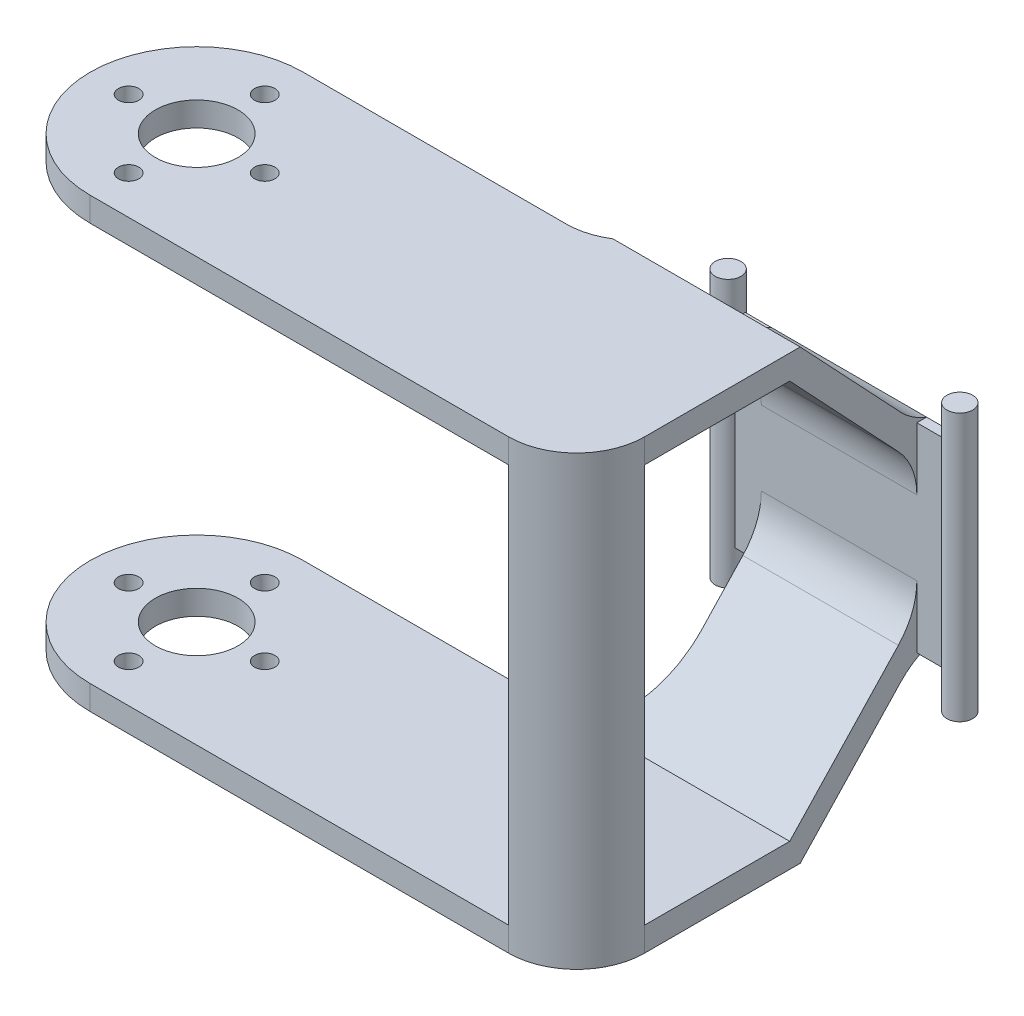
from build123d import *

# Parameters (mm, degrees)
SKETCH1_W           = 23.83
SKETCH1_H           = 1
BOSS_EXTRUDE1_DEPTH = 20.5
SKETCH2_R           = 1.325
BOSS_EXTRUDE2_DEPTH = 13.75
BOSS_EXTRUDE4_DEPTH = 8
SKETCH5_W           = 21.919818374
SKETCH5_H           = 2.5
BOSS_EXTRUDE5_DEPTH = 45
SKETCH6_R           = 4.25
SKETCH6_R_2         = 1.05
CUT_EXTRUDE1_DEPTH  = 79.646360374
FILLET1_R           = 7
FILLET2_R           = 7
FILLET3_R           = 7
BOSS_EXTRUDE6_START = 41
BOSS_EXTRUDE6_DEPTH = 41


with BuildPart() as part:
    # Sketch1 → Boss-Extrude1 (new body)
    with BuildSketch(Plane(origin=(0, 0, 0), x_dir=(1, 0, 0), z_dir=(0, 1, 0))):
        Rectangle(SKETCH1_W, SKETCH1_H)
    extrude(amount=BOSS_EXTRUDE1_DEPTH)

    # Sketch2 → Boss-Extrude2 (add, symmetric)
    with BuildSketch(Plane(origin=(0, 10.25, 0), x_dir=(1, 0, 0), z_dir=(0, 1, 0))):
        with Locations(Location((-11.915, 0, 0), (0, 0, 270))):
            Circle(SKETCH2_R)
        with Locations(Location((11.915, 0, 0), (0, 0, 270))):
            Circle(SKETCH2_R)
    extrude(amount=BOSS_EXTRUDE2_DEPTH, both=True)

    # Sketch4 → Boss-Extrude4 (add, symmetric)
    with BuildSketch(Plane(origin=(0, 0, 0), x_dir=(0, 0, -1), z_dir=(1, 0, 0))):
        Polygon((-0.5, 16.852307022), (-0.5, 20.5), (-12.5, 33.25), (-35.5, 33.25), (-35.5, 30.75), (-13.580181626, 30.75), align=None)
        Polygon((-0.5, 0), (-0.5, 3.647692978), (-13.580181626, -10.25), (-35.5, -10.25), (-35.5, -12.75), (-12.5, -12.75), align=None)
    extrude(amount=BOSS_EXTRUDE4_DEPTH, both=True)

    # Sketch5 → Boss-Extrude5 (add)
    with BuildSketch(Plane.ZY.offset(8)):
        with Locations((24.540090813, 32)):
            Rectangle(SKETCH5_W, SKETCH5_H)
        with Locations((24.540090813, -11.5)):
            Rectangle(SKETCH5_W, SKETCH5_H)
    extrude(amount=BOSS_EXTRUDE5_DEPTH)

    # Sketch6 → Cut-Extrude1 (cut, through all)
    with BuildSketch(Plane(origin=(0, 33.25, 0), x_dir=(1, 0, 0), z_dir=(0, 1, 0))):
        with Locations(Location((-42.040090813, -24.540090813, 0), (0, 0, 270))):
            Circle(SKETCH6_R)
        with Locations(Location((-49.040090813, -24.540090813, 0), (0, 0, 270))):
            Circle(SKETCH6_R_2)
        with Locations(Location((-42.040090813, -17.540090813, 0), (0, 0, 270))):
            Circle(SKETCH6_R_2)
        with Locations(Location((-35.040090813, -24.540090813, 0), (0, 0, 270))):
            Circle(SKETCH6_R_2)
        with Locations(Location((-42.040090813, -31.540090813, 0), (0, 0, 270))):
            Circle(SKETCH6_R_2)
        with BuildLine():
            ThreePointArc((-53, -24.540090813), (-49.78991692, -16.790264706), (-42.040090813, -13.580181626))
            Line((-42.040090813, -13.580181626), (-53, -13.580181626))
            Line((-53, -13.580181626), (-53, -24.540090813))
        make_face()
        with BuildLine():
            ThreePointArc((-42.040090813, -35.5), (-49.78991692, -32.28991692), (-53, -24.540090813))
            Line((-53, -24.540090813), (-53, -35.5))
            Line((-53, -35.5), (-42.040090813, -35.5))
        make_face()
    extrude(amount=-CUT_EXTRUDE1_DEPTH, mode=Mode.SUBTRACT)

    # Fillet1
    # the kernel refuses this fillet: 7 mm, written as the material it adds along each edge
    with BuildSketch(Plane(origin=(-8, -12.75, 13.580181626), x_dir=(-1, 0, 0), z_dir=(0, 1, 0))) as fillet1_piece_1_section:
        with BuildLine():
            CenterArc((FILLET1_R, -FILLET1_R), FILLET1_R, 90, 90)
            Line((0, -FILLET1_R), (0, 0))
            Line((0, 0), (FILLET1_R, 0))
        make_face()
    fillet1_piece_1 = extrude(amount=2.5, mode=Mode.PRIVATE)
    fillet1_piece_1 = split(fillet1_piece_1, bisect_by=Plane(origin=(-10.020174451, -12.153760937, 11.938833823), z_dir=(0, 0.6853646990049913, 0.7281999926928027)), keep=Keep.TOP, mode=Mode.PRIVATE)
    fillet1_piece_1 = split(fillet1_piece_1, bisect_by=Plane(origin=(-10.020174451, -10.440349189, 13.759333804), z_dir=(0, -0.685364699004991, -0.7281999926928029)), keep=Keep.TOP, mode=Mode.PRIVATE)
    add(fillet1_piece_1)
    with BuildSketch(Plane(origin=(-8, -12.75, 13.580181626), x_dir=(-1, 0, 0), z_dir=(0, 1, 0))) as fillet1_piece_2_section:
        with BuildLine():
            CenterArc((FILLET1_R, -FILLET1_R), FILLET1_R, 90, 90)
            Line((0, -FILLET1_R), (0, 0))
            Line((0, 0), (FILLET1_R, 0))
        make_face()
    fillet1_piece_2 = extrude(amount=20, mode=Mode.PRIVATE)
    fillet1_piece_2 = split(fillet1_piece_2, bisect_by=Plane(origin=(-8.816209607, -9.698679662, 9.628169093), z_dir=(0, 0.6853646990049913, 0.7281999926928027)), keep=Keep.TOP, mode=Mode.PRIVATE)
    fillet1_piece_2 = split(fillet1_piece_2, bisect_by=Plane(origin=(-8.816209607, -10.25, 10.809130305), z_dir=(0, 1, 0)), keep=Keep.TOP, mode=Mode.PRIVATE)
    fillet1_piece_2 = split(fillet1_piece_2, bisect_by=Plane(origin=(-8.816209607, -7.985267914, 11.448669075), z_dir=(0, -0.685364699004991, -0.7281999926928029)), keep=Keep.TOP, mode=Mode.PRIVATE)
    add(fillet1_piece_2)
    with BuildSketch(Plane(origin=(-8, 33.25, 13.580181626), x_dir=(0, 0, -1), z_dir=(0, -1, 0))) as fillet1_piece_3_section:
        with BuildLine():
            CenterArc((FILLET1_R, -FILLET1_R), FILLET1_R, 90, 90)
            Line((0, -FILLET1_R), (0, 0))
            Line((0, 0), (FILLET1_R, 0))
        make_face()
    fillet1_piece_3 = extrude(amount=2.5, mode=Mode.PRIVATE)
    fillet1_piece_3 = split(fillet1_piece_3, bisect_by=Plane(origin=(-10.020174451, 32.653760936, 11.938833823), z_dir=(0, -0.6853646990049912, 0.7281999926928028)), keep=Keep.TOP, mode=Mode.PRIVATE)
    fillet1_piece_3 = split(fillet1_piece_3, bisect_by=Plane(origin=(-10.020174451, 30.940349189, 13.759333804), z_dir=(0, 0.6853646990049909, -0.7281999926928031)), keep=Keep.TOP, mode=Mode.PRIVATE)
    add(fillet1_piece_3)
    with BuildSketch(Plane(origin=(-8, 33.25, 13.580181626), x_dir=(0, 0, -1), z_dir=(0, -1, 0))) as fillet1_piece_4_section:
        with BuildLine():
            CenterArc((FILLET1_R, -FILLET1_R), FILLET1_R, 90, 90)
            Line((0, -FILLET1_R), (0, 0))
            Line((0, 0), (FILLET1_R, 0))
        make_face()
    fillet1_piece_4 = extrude(amount=20, mode=Mode.PRIVATE)
    fillet1_piece_4 = split(fillet1_piece_4, bisect_by=Plane(origin=(-8.816209616, 30.198679665, 9.628169097), z_dir=(0, -0.6853646990049912, 0.7281999926928028)), keep=Keep.TOP, mode=Mode.PRIVATE)
    fillet1_piece_4 = split(fillet1_piece_4, bisect_by=Plane(origin=(-8.816209616, 28.485267918, 11.448669078), z_dir=(0, 0.6853646990049909, -0.7281999926928031)), keep=Keep.TOP, mode=Mode.PRIVATE)
    fillet1_piece_4 = split(fillet1_piece_4, bisect_by=Plane(origin=(-8.816209616, 30.75, 10.809130308), z_dir=(0, -1, 0)), keep=Keep.TOP, mode=Mode.PRIVATE)
    add(fillet1_piece_4)
    # the kernel refuses this fillet: 7 mm, written as the material it takes off along each edge
    with BuildSketch(Plane(origin=(8, 7.25, 35.5), x_dir=(0, 0, -1), z_dir=(0, -1, 0))) as fillet1_2_piece_1:
        with BuildLine():
            CenterArc((FILLET1_R, -FILLET1_R), FILLET1_R, 90, 90)
            Line((0, -FILLET1_R), (0, 0))
            Line((0, 0), (FILLET1_R, 0))
        make_face()
    extrude(amount=37.5, mode=Mode.SUBTRACT)
    with BuildSketch(Plane(origin=(8, 50.75, 35.5), x_dir=(-1, 0, 0), z_dir=(0, -1, 0))) as fillet1_2_piece_2:
        with BuildLine():
            CenterArc((FILLET1_R, FILLET1_R), FILLET1_R, 180, 90)
            Line((0, FILLET1_R), (0, 0))
            Line((0, 0), (FILLET1_R, 0))
        make_face()
    extrude(amount=37.5, mode=Mode.SUBTRACT)

    # Fillet2
    fillet2_edges = [part.edges().sort_by_distance(p)[0] for p in [
        (0, 16.852307022, 0.5),
        (0, 3.647692978, 0.5),
    ]]
    fillet(fillet2_edges, radius=FILLET2_R)

    # Fillet3
    # the kernel refuses this fillet: 7 mm, written as the material it adds along each edge
    with BuildSketch(Plane(origin=(-8, 20.5, 0.5), x_dir=(0, 0.7281999926925888, 0.6853646990052185), z_dir=(1, 0, 0))) as fillet3_piece_1:
        with BuildLine():
            CenterArc((2.423417163, -7), FILLET3_R, 90, 26.366519243)
            Line((-0.685364699, -0.728199993), (0, 0))
            Line((0, 0), (2.423417163, 0))
        make_face()
    extrude(amount=16)
    with BuildSketch(Plane(origin=(8, 0, 0.5), x_dir=(0, 0, -1), z_dir=(-1, 0, 0))) as fillet3_piece_2:
        with BuildLine():
            CenterArc((3.436475374, 6.562285254), FILLET3_R, 223.264295411, 26.366519243)
            Line((-1.660924575, 1.764732361), (0, 0))
            Line((0, 0), (1, 0))
        make_face()
    extrude(amount=16)

    # Sketch8 → Boss-Extrude6 (add)
    with BuildSketch(Plane(origin=(0, -10.25, 0), x_dir=(1, 0, 0), z_dir=(0, 1, 0)).offset(BOSS_EXTRUDE6_START)):
        with BuildLine():
            ThreePointArc((1, -35.5), (5.949747468, -33.449747468), (8, -28.5))
            Line((8, -28.5), (5, -28.5))
            ThreePointArc((5, -28.5), (3.422054899, -30.922054899), (1, -32.5))
            Line((1, -32.5), (1, -35.5))
        make_face()
    extrude(amount=-BOSS_EXTRUDE6_DEPTH)


solid = part.part
